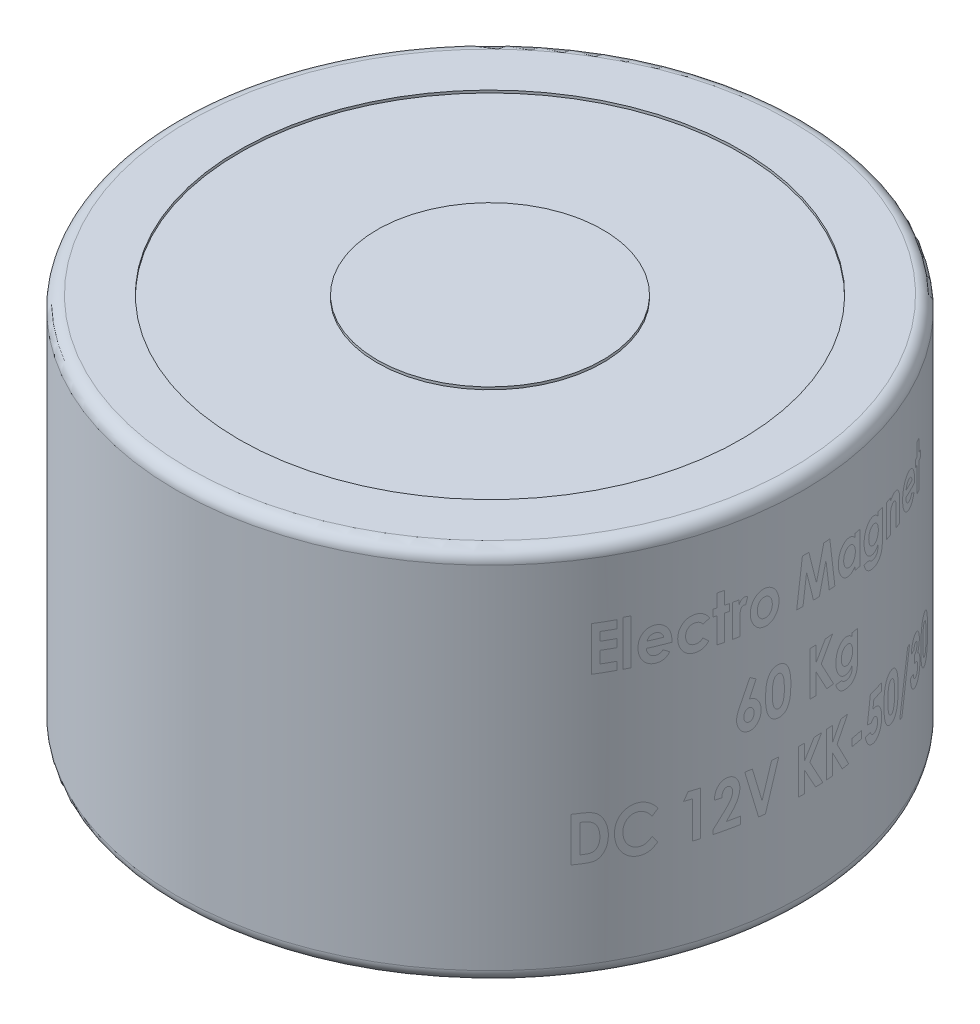
from build123d import *

# Parameters (mm, degrees)
SKETCH1_R           = 25
BOSS_EXTRUDE1_DEPTH = 30
SKETCH2_R           = 20
SKETCH2_R_2         = 9
CUT_EXTRUDE1_DEPTH  = 0.2
FILLET1_R           = 1
SKETCH6_R           = 0.6
BOSS_EXTRUDE2_DEPTH = 2
SKETCH3_R           = 2.5
CUT_EXTRUDE2_DEPTH  = 6


with BuildPart() as part:
    # Sketch1 → Boss-Extrude1 (new body)
    with BuildSketch(Plane(origin=(0, 0, 0), x_dir=(1, 0, 0), z_dir=(0, 1, 0))):
        Circle(SKETCH1_R)
    extrude(amount=BOSS_EXTRUDE1_DEPTH)

    # Sketch2 → Cut-Extrude1 (cut)
    with BuildSketch(Plane(origin=(0, 30, 0), x_dir=(1, 0, 0), z_dir=(0, 1, 0))):
        Circle(SKETCH2_R)
        Circle(SKETCH2_R_2, mode=Mode.SUBTRACT)
    extrude(amount=-CUT_EXTRUDE1_DEPTH, mode=Mode.SUBTRACT)

    # Fillet1
    fillet1_edges = [part.edges().sort_by_distance(p)[0] for p in [
        (-25, 30, 0),
        (-25, 0, 0),
    ]]
    fillet(fillet1_edges, radius=FILLET1_R)

    # Sweep1: sweep along a path in Sketch5
    with BuildLine(Plane(origin=(0, 0, 0), x_dir=(0, 0, -1), z_dir=(1, 0, 0))) as sweep1_path:
        Line((0, 5), (25, 5))
        ThreePointArc((25, 5), (27.121320344, 4.121320344), (28, 2))
        Line((28, 2), (28, -10))
    # Sketch4 → Sweep1 (sweep)
    with BuildSketch(Plane.XY):
        with BuildLine():
            ThreePointArc((0, 6.118033989), (-2.5, 5), (0, 3.881966011))
            ThreePointArc((0, 3.881966011), (2.5, 5), (0, 6.118033989))
        make_face()
    sweep(path=sweep1_path.line)

    # Sketch6 → Boss-Extrude2 (add)
    with BuildSketch(Plane.XZ.offset(10)):
        with Locations((-1, -28)):
            Circle(SKETCH6_R)
        with Locations((1, -28)):
            Circle(SKETCH6_R)
    extrude(amount=BOSS_EXTRUDE2_DEPTH)

    # Sketch3 → Cut-Extrude2 (cut)
    with BuildSketch(Plane.XZ):
        Circle(SKETCH3_R)
    extrude(amount=-CUT_EXTRUDE2_DEPTH, mode=Mode.SUBTRACT)


solid = part.part
